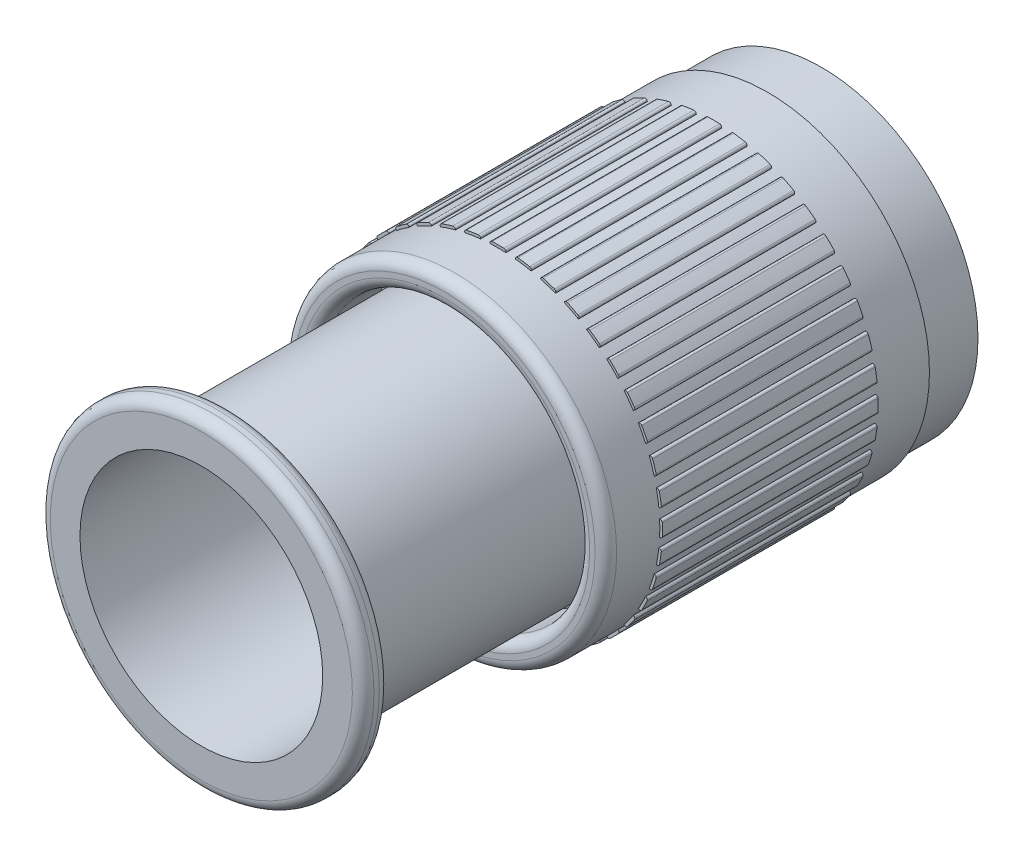
from build123d import *

# Parameters (mm, degrees)
SKETCH1_R           = 29
BOSS_EXTRUDE1_DEPTH = 10
SKETCH2_R           = 30
BOSS_EXTRUDE2_DEPTH = 50
BOSS_EXTRUDE3_START = -40
BOSS_EXTRUDE3_DEPTH = 40
CIRPATTERN1_COUNT   = 40
SKETCH4_R           = 30
BOSS_EXTRUDE4_DEPTH = 10
SKETCH5_R           = 25
CUT_EXTRUDE1_DEPTH  = 10
FILLET1_R           = 2
SKETCH6_R           = 24
BOSS_EXTRUDE5_DEPTH = 50
SKETCH7_R           = 30
BOSS_EXTRUDE6_DEPTH = 5
FILLET2_R           = 2
SKETCH9_R           = 22.5
CUT_EXTRUDE3_DEPTH  = 123.823043441
SCALE1_SCALE        = 0.75


with BuildPart() as part:
    # Sketch1 → Boss-Extrude1 (new body)
    with BuildSketch(Plane.XY):
        Circle(SKETCH1_R)
    extrude(amount=BOSS_EXTRUDE1_DEPTH)

    # Sketch2 → Boss-Extrude2 (add)
    with BuildSketch(Plane.XY.offset(10)):
        Circle(SKETCH2_R)
    extrude(amount=BOSS_EXTRUDE2_DEPTH)

    # Sketch3 → Boss-Extrude3 (add)
    with BuildSketch(Plane.XY.offset(60).offset(BOSS_EXTRUDE3_START)):
        with BuildLine():
            Line((-1.480197151, 30.060921749), (-1.475409836, 29.963697466))
            ThreePointArc((-1.475409836, 29.963697466), (0, 30), (1.475409836, 29.963697466))
            Line((1.475409836, 29.963697466), (1.480197151, 30.060921749))
            ThreePointArc((1.480197151, 30.060921749), (1.375300696, 30.351147652), (1.095042397, 30.480335991))
            ThreePointArc((1.095042397, 30.480335991), (0, 30.5), (-1.095042397, 30.480335991))
            ThreePointArc((-1.095042397, 30.480335991), (-1.375300696, 30.351147652), (-1.480197151, 30.060921749))
        make_face()
    boss_extrude3 = extrude(amount=BOSS_EXTRUDE3_DEPTH)

    # CirPattern1: Boss-Extrude3 ×40 about axis
    cirpattern1_axis = Axis((0, 0, 10), (0, 0, -1))
    for i in range(1, CIRPATTERN1_COUNT):
        add(boss_extrude3.rotate(cirpattern1_axis, i * 360 / CIRPATTERN1_COUNT))

    # Sketch4 → Boss-Extrude4 (add)
    with BuildSketch(Plane.XY.offset(60)):
        Circle(SKETCH4_R)
    extrude(amount=BOSS_EXTRUDE4_DEPTH)

    # Sketch5 → Cut-Extrude1 (cut)
    with BuildSketch(Plane.XY.offset(70)):
        Circle(SKETCH5_R)
    extrude(amount=-CUT_EXTRUDE1_DEPTH, mode=Mode.SUBTRACT)

    # Fillet1
    fillet1_edges = [part.edges().sort_by_distance(p)[0] for p in [
        (-30, 0, 70),
        (-25, 0, 70),
    ]]
    fillet(fillet1_edges, radius=FILLET1_R)

    # Sketch6 → Boss-Extrude5 (add)
    with BuildSketch(Plane.XY.offset(60)):
        Circle(SKETCH6_R)
    extrude(amount=BOSS_EXTRUDE5_DEPTH)

    # Sketch7 → Boss-Extrude6 (add)
    with BuildSketch(Plane.XY.offset(110)):
        Circle(SKETCH7_R)
    extrude(amount=BOSS_EXTRUDE6_DEPTH)

    # Fillet2
    fillet2_edges = [part.edges().sort_by_distance(p)[0] for p in [
        (-30, 0, 110),
        (-30, 0, 115),
    ]]
    fillet(fillet2_edges, radius=FILLET2_R)

    # Sketch9 → Cut-Extrude3 (cut, through all)
    with BuildSketch(Plane.XY.offset(115)):
        Circle(SKETCH9_R)
    extrude(amount=-CUT_EXTRUDE3_DEPTH, mode=Mode.SUBTRACT)


with BuildPart() as part_1:
    # Scale1: scaled about (0, 0, 44.491186479)
    add(part.part.scale(SCALE1_SCALE).moved(Location((0, 0, 11.12279662))))


solid = part_1.part
